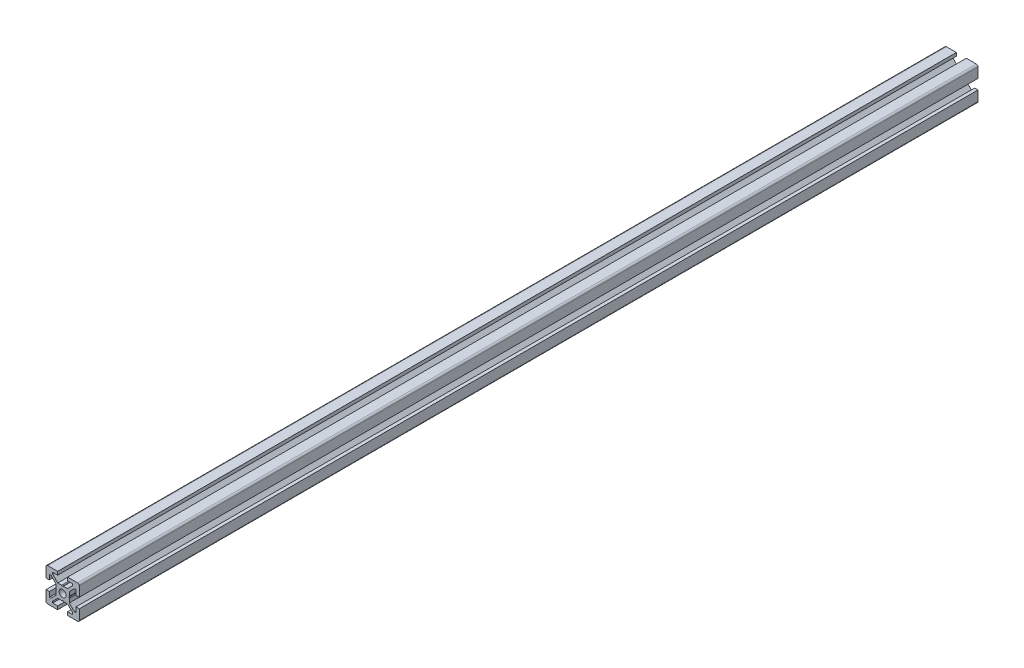
from build123d import *

# Parameters (mm, degrees)
SKETCH1_R           = 2.1
BOSS_EXTRUDE1_DEPTH = 540


with BuildPart() as part:
    # Sketch1 → Boss-Extrude1 (new body)
    with BuildSketch(Plane(origin=(0, 0, -500), x_dir=(-1, 0, 0), z_dir=(0, 0, -1))):
        with BuildLine():
            Line((9, 10), (3, 10))
            Line((3, 10), (3, 8))
            Line((3, 8), (6, 8))
            Line((6, 8), (6, 7.060660172))
            Line((6, 7.060660172), (2.939339828, 4))
            Line((2.939339828, 4), (0.519615242, 4))
            Line((0.519615242, 4), (0, 3.7))
            Line((0, 3.7), (-0.519615242, 4))
            Line((-0.519615242, 4), (-2.939339828, 4))
            Line((-2.939339828, 4), (-6, 7.060660172))
            Line((-6, 7.060660172), (-6, 8))
            Line((-6, 8), (-3, 8))
            Line((-3, 8), (-3, 10))
            Line((-3, 10), (-9, 10))
            ThreePointArc((-9, 10), (-9.707106781, 9.707106781), (-10, 9))
            Line((-10, 9), (-10, 3))
            Line((-10, 3), (-8, 3))
            Line((-8, 3), (-8, 6))
            Line((-8, 6), (-7.060660172, 6))
            Line((-7.060660172, 6), (-4, 2.939339828))
            Line((-4, 2.939339828), (-4, 0.519615242))
            Line((-4, 0.519615242), (-3.7, 0))
            Line((-3.7, 0), (-4, -0.519615242))
            Line((-4, -0.519615242), (-4, -2.939339828))
            Line((-4, -2.939339828), (-7.060660172, -6))
            Line((-7.060660172, -6), (-8, -6))
            Line((-8, -6), (-8, -3))
            Line((-8, -3), (-10, -3))
            Line((-10, -3), (-10, -9))
            ThreePointArc((-10, -9), (-9.707106781, -9.707106781), (-9, -10))
            Line((-9, -10), (-3, -10))
            Line((-3, -10), (-3, -8))
            Line((-3, -8), (-6, -8))
            Line((-6, -8), (-6, -7.060660172))
            Line((-6, -7.060660172), (-2.939339828, -4))
            Line((-2.939339828, -4), (-0.519615242, -4))
            Line((-0.519615242, -4), (0, -3.7))
            Line((0, -3.7), (0.519615242, -4))
            Line((0.519615242, -4), (2.939339828, -4))
            Line((2.939339828, -4), (6, -7.060660172))
            Line((6, -7.060660172), (6, -8))
            Line((6, -8), (3, -8))
            Line((3, -8), (3, -10))
            Line((3, -10), (9, -10))
            ThreePointArc((9, -10), (9.707106781, -9.707106781), (10, -9))
            Line((10, -9), (10, -3))
            Line((10, -3), (8, -3))
            Line((8, -3), (8, -6))
            Line((8, -6), (7.060660172, -6))
            Line((7.060660172, -6), (4, -2.939339828))
            Line((4, -2.939339828), (4, -0.519615242))
            Line((4, -0.519615242), (3.7, 0))
            Line((3.7, 0), (4, 0.519615242))
            Line((4, 0.519615242), (4, 2.939339828))
            Line((4, 2.939339828), (7.060660172, 6))
            Line((7.060660172, 6), (8, 6))
            Line((8, 6), (8, 3))
            Line((8, 3), (10, 3))
            Line((10, 3), (10, 9))
            ThreePointArc((10, 9), (9.707106781, 9.707106781), (9, 10))
        make_face()
        Circle(SKETCH1_R, mode=Mode.SUBTRACT)
    extrude(amount=-BOSS_EXTRUDE1_DEPTH)


solid = part.part
